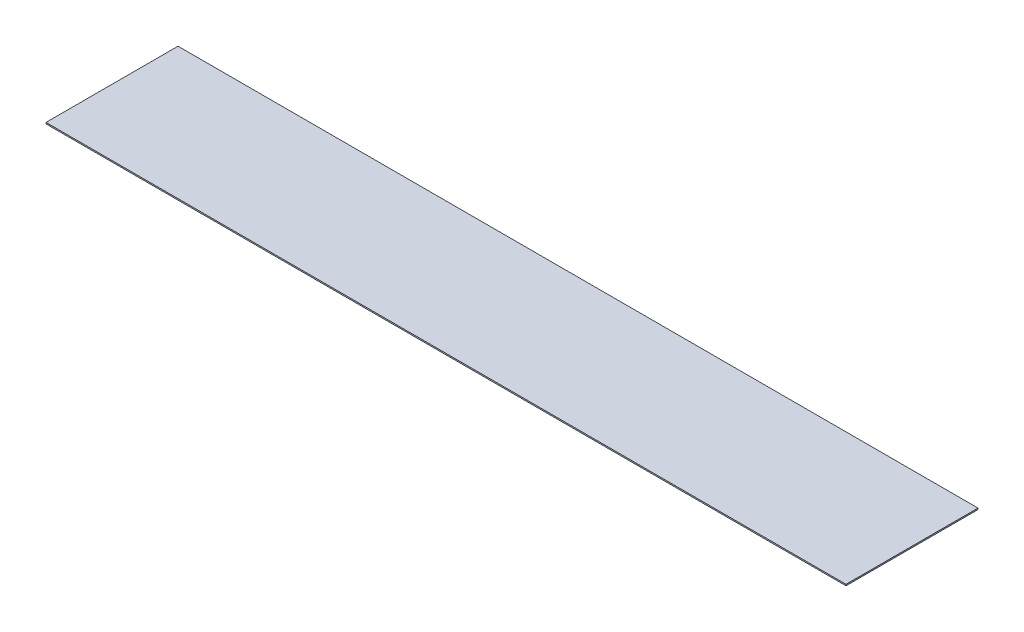
from build123d import *

# Parameters (mm, degrees)
SKETCH1_W          = 1200
SKETCH1_H          = 198
BASE_FLANGE1_DEPTH = 2


# Sheet-metal steps are written as plain solids
with BuildPart() as part:
    # Sketch1 → Base-Flange1 (new body)
    with BuildSketch(Plane(origin=(0, 0, 0), x_dir=(1, 0, 0), z_dir=(0, 1, 0))):
        Rectangle(SKETCH1_W, SKETCH1_H)
    extrude(amount=-BASE_FLANGE1_DEPTH)


solid = part.part
